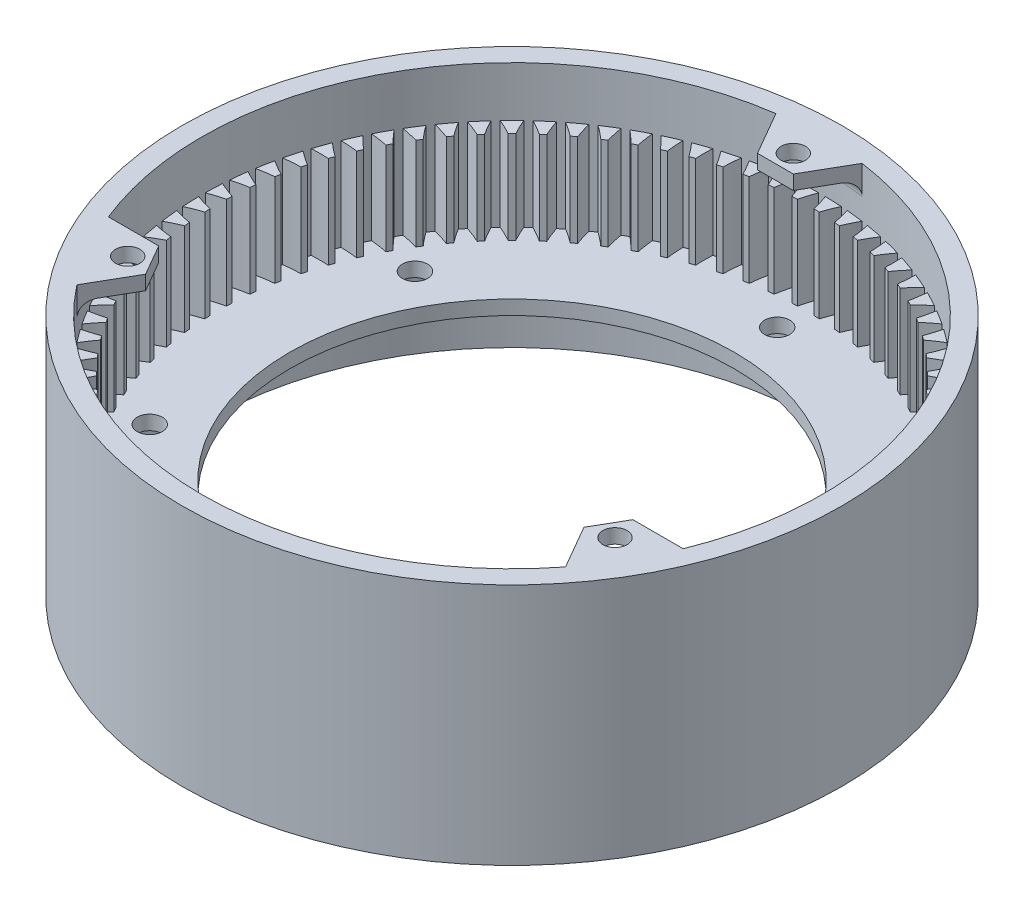
from build123d import *

# Parameters (mm, degrees)
SKETCH3_W           = 5
SKETCH3_H           = 12.9
CUT_EXTRUDE1_DEPTH  = 12.9
CIRPATTERN1_COUNT   = 84
BOSS_EXTRUDE2_START = 2
SKETCH5_R           = 46
SKETCH5_R_2         = 31
SKETCH5_R_3         = 1.75
BOSS_EXTRUDE2_DEPTH = 2
BOSS_EXTRUDE3_START = 12
SKETCH6_R           = 46
SKETCH6_R_2         = 42.5
BOSS_EXTRUDE3_DEPTH = 12
BOSS_EXTRUDE4_START = 7
SKETCH7_R           = 46
SKETCH7_R_2         = 43.251
BOSS_EXTRUDE4_DEPTH = 7
SKETCH9_R           = 1.7
BOSS_EXTRUDE5_DEPTH = 2
CIRPATTERN2_COUNT   = 3
FILLET1_R           = 2


with BuildPart() as part:
    # Sketch3 → Revolve1 (revolve)
    with BuildSketch(Plane(origin=(0, 0, 0), x_dir=(0, 0, -1), z_dir=(1, 0, 0)), mode=Mode.PRIVATE) as revolve1_sk:
        with Locations((-43.5, 0)):
            Rectangle(SKETCH3_W, SKETCH3_H)
    revolve(revolve1_sk.sketch.rotate(Axis((0, -536.862687651, 0), (0, 1, 0)), 90), axis=Axis((0, -536.862687651, 0), (0, 1, 0)))

    # Sketch4 → Cut-Extrude1 (cut)
    with BuildSketch(Plane(origin=(0, 6.45, 0), x_dir=(1, 0, 0), z_dir=(0, 1, 0))):
        with BuildLine():
            ThreePointArc((1.164650016, 40.95804482), (0.842779433, 42.113453494), (0.455470185, 43.248601687))
            ThreePointArc((0.455470185, 43.248601687), (0, 43.251), (-0.455470185, 43.248601687))
            ThreePointArc((-0.455470185, 43.248601687), (-0.842779433, 42.113453494), (-1.164650016, 40.95804482))
            ThreePointArc((-1.164650016, 40.95804482), (0, 40.9746), (1.164650016, 40.95804482))
        make_face()
    cut_extrude1 = extrude(amount=-CUT_EXTRUDE1_DEPTH, mode=Mode.SUBTRACT)

    # CirPattern1: Cut-Extrude1 ×84 about axis
    cirpattern1_axis = Axis((0, 0, 0), (0, 1, 0))
    for i in range(1, CIRPATTERN1_COUNT):
        add(cut_extrude1.rotate(cirpattern1_axis, i * 360 / CIRPATTERN1_COUNT), mode=Mode.SUBTRACT)

    # Sketch5 → Boss-Extrude2 (add)
    with BuildSketch(Plane.XZ.offset(6.45).offset(BOSS_EXTRUDE2_START)):
        Circle(SKETCH5_R)
        Circle(SKETCH5_R_2, mode=Mode.SUBTRACT)
        with Locations((0, 37)):
            Circle(SKETCH5_R_3, mode=Mode.SUBTRACT)
        with Locations((32.04293994, 18.5)):
            Circle(SKETCH5_R_3, mode=Mode.SUBTRACT)
        with Locations((32.04293994, -18.5)):
            Circle(SKETCH5_R_3, mode=Mode.SUBTRACT)
        with Locations((0, -37)):
            Circle(SKETCH5_R_3, mode=Mode.SUBTRACT)
        with Locations((-32.04293994, -18.5)):
            Circle(SKETCH5_R_3, mode=Mode.SUBTRACT)
        with Locations((-32.04293994, 18.5)):
            Circle(SKETCH5_R_3, mode=Mode.SUBTRACT)
    extrude(amount=-BOSS_EXTRUDE2_DEPTH)

    # Sketch6 → Boss-Extrude3 (add)
    with BuildSketch(Plane.XZ.offset(8.45).offset(BOSS_EXTRUDE3_START)):
        Circle(SKETCH6_R)
        Circle(SKETCH6_R_2, mode=Mode.SUBTRACT)
    extrude(amount=-BOSS_EXTRUDE3_DEPTH)

    # Sketch7 → Boss-Extrude4 (add)
    with BuildSketch(Plane(origin=(0, 6.45, 0), x_dir=(1, 0, 0), z_dir=(0, 1, 0)).offset(BOSS_EXTRUDE4_START)):
        Circle(SKETCH7_R)
        with Locations(Location((0, 0, 0), (0, 0, 180))):
            Circle(SKETCH7_R_2, mode=Mode.SUBTRACT)
    extrude(amount=-BOSS_EXTRUDE4_DEPTH)

    # Sketch9 → Boss-Extrude5 (add)
    with BuildSketch(Plane(origin=(0, 13.45, 0), x_dir=(1, 0, 0), z_dir=(0, 1, 0))):
        with BuildLine():
            Line((-6.01048203, 42.831333236), (-2.5, 36.751))
            Line((-2.5, 36.751), (2.5, 36.751))
            Line((2.5, 36.751), (6.01048203, 42.831333236))
            ThreePointArc((6.01048203, 42.831333236), (0, 43.251), (-6.01048203, 42.831333236))
        make_face()
        with Locations(Location((0, 39.251, 0), (0, 0, 180))):
            Circle(SKETCH9_R, mode=Mode.SUBTRACT)
    boss_extrude5 = extrude(amount=-BOSS_EXTRUDE5_DEPTH)

    # CirPattern2: Boss-Extrude5 ×3 about axis
    cirpattern2_axis = Axis((0, 0, 0), (0, 1, 0))
    for i in range(1, CIRPATTERN2_COUNT):
        add(boss_extrude5.rotate(cirpattern2_axis, i * 360 / CIRPATTERN2_COUNT))

    # Fillet1
    fillet1_edges = [part.edges().sort_by_distance(p)[0] for p in [
        (0, 11.45, -43.251),
        (-37.456464739, 11.45, 21.6255),
        (37.456464739, 11.45, 21.6255),
    ]]
    fillet(fillet1_edges, radius=FILLET1_R)


solid = part.part
